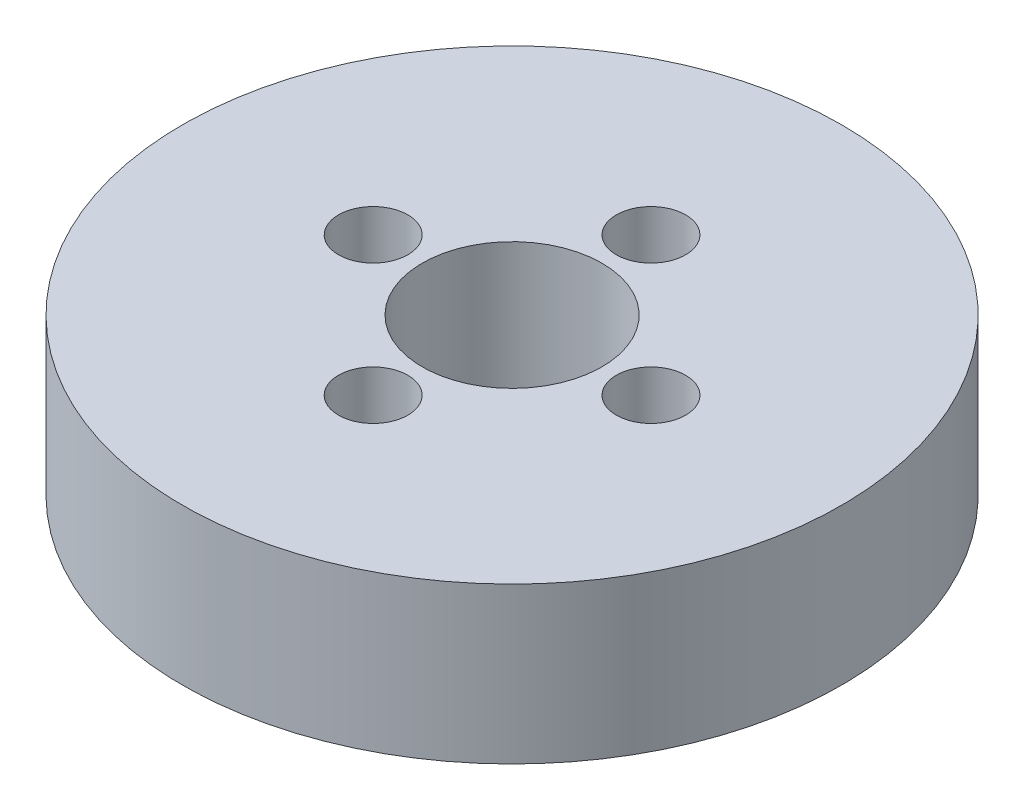
from build123d import *

# Parameters (mm, degrees)
SKETCH1_R           = 55
BOSS_EXTRUDE1_DEPTH = 26
SKETCH2_R           = 15
CUT_EXTRUDE1_DEPTH  = 83.012194215
SKETCH3_R           = 5.781917359
CUT_EXTRUDE2_DEPTH  = 24.435946377
CIRPATTERN1_COUNT   = 4


with BuildPart() as part:
    # Sketch1 → Boss-Extrude1 (new body)
    with BuildSketch(Plane(origin=(0, 0, 0), x_dir=(1, 0, 0), z_dir=(0, 1, 0))):
        Circle(SKETCH1_R)
    extrude(amount=BOSS_EXTRUDE1_DEPTH)

    # Sketch2 → Cut-Extrude1 (cut, through all)
    with BuildSketch(Plane(origin=(0, 0, 0), x_dir=(1, 0, 0), z_dir=(0, 1, 0))):
        Circle(SKETCH2_R)
    extrude(amount=CUT_EXTRUDE1_DEPTH, mode=Mode.SUBTRACT)

    # Sketch3 → Cut-Extrude2 (cut)
    with BuildSketch(Plane(origin=(0, 26, 0), x_dir=(1, 0, 0), z_dir=(0, 1, 0))):
        with Locations((-23.181135157, 0)):
            Circle(SKETCH3_R)
    cut_extrude2 = extrude(amount=-CUT_EXTRUDE2_DEPTH, mode=Mode.SUBTRACT)

    # CirPattern1: Cut-Extrude2 ×4 about axis
    cirpattern1_axis = Axis((0, 0, 0), (0, 1, 0))
    for i in range(1, CIRPATTERN1_COUNT):
        add(cut_extrude2.rotate(cirpattern1_axis, i * 360 / CIRPATTERN1_COUNT), mode=Mode.SUBTRACT)


solid = part.part
